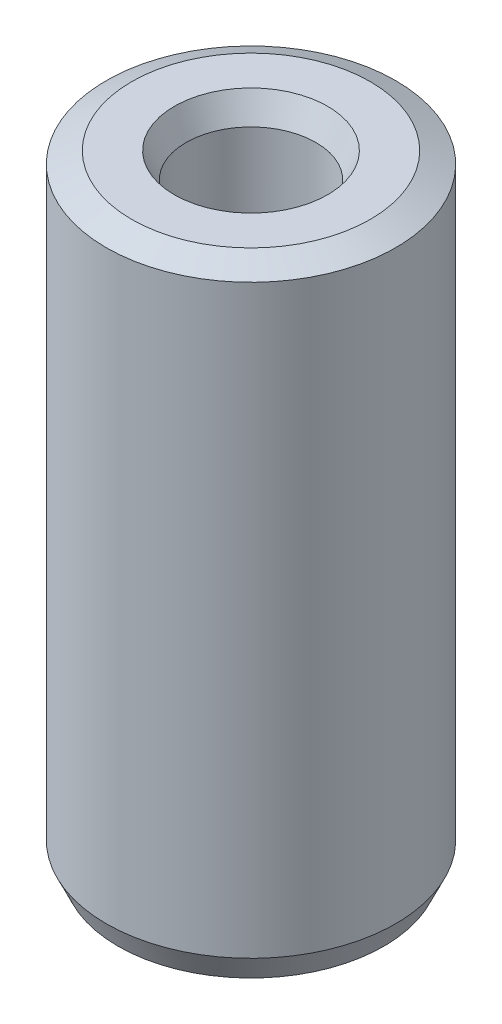
from build123d import *
from OCP.BRepFilletAPI import BRepFilletAPI_MakeChamfer

# Parameters (mm, degrees)
SKETCH1_R           = 5
BOSS_EXTRUDE1_DEPTH = 21.511003231
SKETCH2_R           = 2.240860642
CUT_EXTRUDE1_DEPTH  = 23.643393297
CHAMFER1_SIZE       = 0.407593185
CHAMFER1_SIZE2      = 0.877956717


with BuildPart() as part:
    # Sketch1 → Boss-Extrude1 (new body)
    with BuildSketch(Plane(origin=(0, 0, 0), x_dir=(1, 0, 0), z_dir=(0, 1, 0))):
        Circle(SKETCH1_R)
    extrude(amount=BOSS_EXTRUDE1_DEPTH)

    # Sketch2 → Cut-Extrude1 (cut, through all)
    with BuildSketch(Plane(origin=(0, 0, 0), x_dir=(1, 0, 0), z_dir=(0, 1, 0))):
        Circle(SKETCH2_R)
    extrude(amount=CUT_EXTRUDE1_DEPTH, mode=Mode.SUBTRACT)

    # Chamfer1: one chamfer whose edges measure the first distance from different faces: ONE call of the kernel's chamfer builder (chamfer() names one face for all edges)
    chamfer1_edges_1 = [part.edges().sort_by_distance(p)[0] for p in [
        (-2.240860642, 21.511003231, 0),
    ]]
    chamfer1_side_1 = [part.faces().sort_by_distance(p)[0] for p in [
        (-4.858578644, 21.511003231, 0),
    ]]
    chamfer1_edges_2 = [part.edges().sort_by_distance(p)[0] for p in [
        (-2.240860642, 0, 0),
    ]]
    chamfer1_side_2 = [part.faces().sort_by_distance(p)[0] for p in [
        (-2.240860642, 10.755501616, 0),
    ]]
    chamfer1_edges_3 = [part.edges().sort_by_distance(p)[0] for p in [
        (-5, 0, 0),
    ]]
    chamfer1_side_3 = [part.faces().sort_by_distance(p)[0] for p in [
        (-4.858578644, 0, 0),
    ]]
    chamfer1_edges_4 = [part.edges().sort_by_distance(p)[0] for p in [
        (-5, 21.511003231, 0),
    ]]
    chamfer1_side_4 = [part.faces().sort_by_distance(p)[0] for p in [
        (-5, 10.755501616, 0),
    ]]
    chamfer1 = BRepFilletAPI_MakeChamfer(part.part.solid().wrapped)
    for e in chamfer1_edges_1:
        chamfer1.Add(CHAMFER1_SIZE, CHAMFER1_SIZE2, e.wrapped, chamfer1_side_1[0].wrapped)  # the first distance lies on this face
    for e in chamfer1_edges_2:
        chamfer1.Add(CHAMFER1_SIZE, CHAMFER1_SIZE2, e.wrapped, chamfer1_side_2[0].wrapped)  # the first distance lies on this face
    for e in chamfer1_edges_3:
        chamfer1.Add(CHAMFER1_SIZE, CHAMFER1_SIZE2, e.wrapped, chamfer1_side_3[0].wrapped)  # the first distance lies on this face
    for e in chamfer1_edges_4:
        chamfer1.Add(CHAMFER1_SIZE, CHAMFER1_SIZE2, e.wrapped, chamfer1_side_4[0].wrapped)  # the first distance lies on this face
    add(Compound.cast(chamfer1.Shape()), mode=Mode.REPLACE)


solid = part.part
